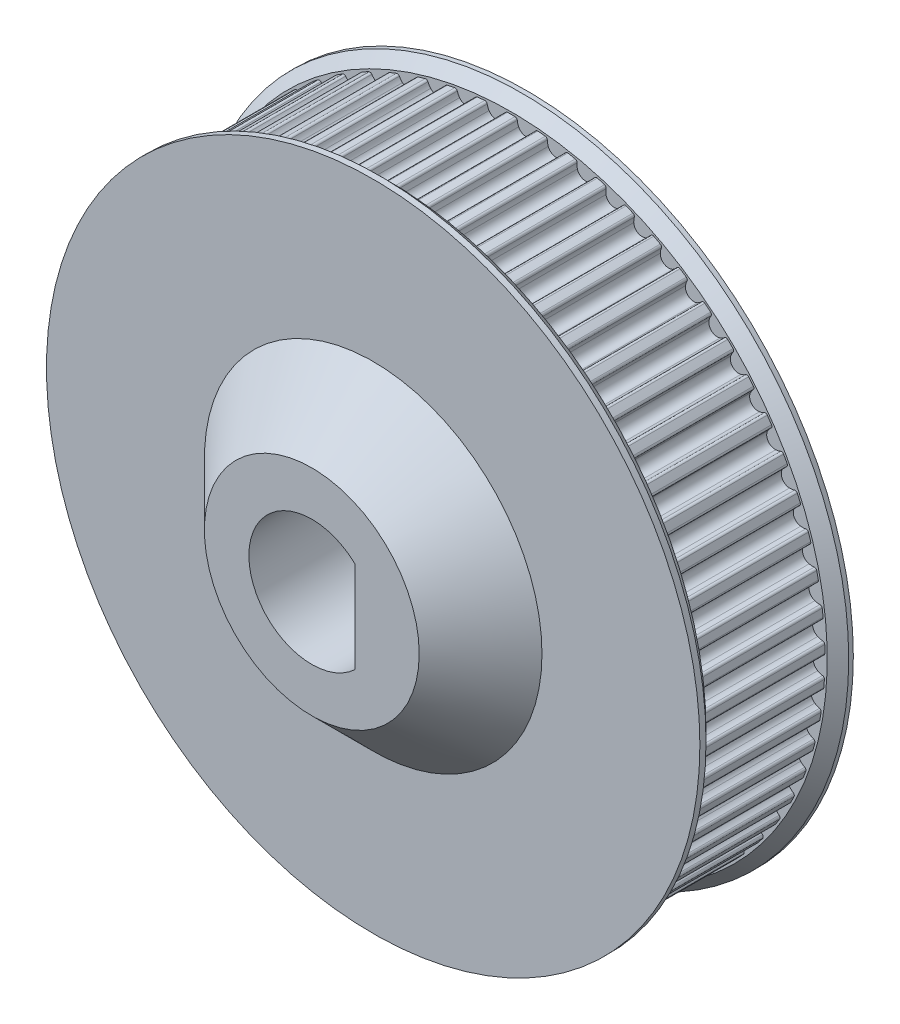
from build123d import *

# Parameters (mm, degrees)
SKETCH1_R           = 20.690142602
BOSS_EXTRUDE1_DEPTH = 4
CUT_EXTRUDE1_DEPTH  = 8
CIRPATTERN1_COUNT   = 65
SKETCH4_R           = 21.290142602
BOSS_EXTRUDE2_DEPTH = 1
CHAMFER1_SIZE       = 0.7
SKETCH6_R           = 7
BOSS_EXTRUDE3_DEPTH = 4
SKETCH5_R           = 4.1
CUT_EXTRUDE2_DEPTH  = 34.204522945
BOSS_EXTRUDE4_DEPTH = 14
CHAMFER2_SIZE       = 4
CHAMFER3_SIZE       = 0.6


with BuildPart() as part:
    # Sketch1 → Boss-Extrude1 (new, symmetric)
    with BuildSketch(Plane.XY):
        Circle(SKETCH1_R)
    extrude(amount=BOSS_EXTRUDE1_DEPTH, both=True)

    # Sketch3 → Cut-Extrude1 (cut)
    with BuildSketch(Plane.XY.offset(4)):
        with BuildLine():
            Line((0, 20.690142602), (0, 20.440142602))
            ThreePointArc((0, 20.440142602), (0.121616533, 20.439780796), (0.243228761, 20.438695393))
            ThreePointArc((0.243228761, 20.438695393), (0.342538687, 20.399520404), (0.390640062, 20.304213536))
            ThreePointArc((0.390640062, 20.304213536), (0.421796483, 20.139835253), (0.479921762, 19.982951874))
            ThreePointArc((0.479921762, 19.982951874), (0.951297332, 19.667148982), (1.450951725, 19.935983286))
            ThreePointArc((1.450951725, 19.935983286), (1.523947083, 20.086524378), (1.570822848, 20.247128255))
            ThreePointArc((1.570822848, 20.247128255), (1.627898107, 20.337347743), (1.73052535, 20.366755058))
            ThreePointArc((1.73052535, 20.366755058), (1.851674604, 20.356098122), (1.972758307, 20.34472055))
            Line((1.972758307, 20.34472055), (1.996886787, 20.593553459))
            ThreePointArc((1.996886787, 20.593553459), (0.999610712, 20.665981209), (0, 20.690142602))
        make_face()
    cut_extrude1 = extrude(amount=-CUT_EXTRUDE1_DEPTH, mode=Mode.SUBTRACT)

    # CirPattern1: Cut-Extrude1 ×65 about axis
    cirpattern1_axis = Axis((0, 0, 0), (0, 0, 1))
    for i in range(1, CIRPATTERN1_COUNT):
        add(cut_extrude1.rotate(cirpattern1_axis, i * 360 / CIRPATTERN1_COUNT), mode=Mode.SUBTRACT)

    # Sketch4 → Boss-Extrude2 (add)
    with BuildSketch(Plane.XY.offset(4)):
        Circle(SKETCH4_R)
    boss_extrude2 = extrude(amount=BOSS_EXTRUDE2_DEPTH)

    # Mirror1: Boss-Extrude2 across plane
    add(boss_extrude2.mirror(Plane.XY))

    # Chamfer1
    chamfer1_edges = [part.edges().sort_by_distance(p)[0] for p in [
        (-21.290142602, 0, -4),
    ]]
    chamfer(chamfer1_edges, length=CHAMFER1_SIZE)

    # Sketch6 → Boss-Extrude3 (add)
    with BuildSketch(Plane.XY.offset(5)):
        Circle(SKETCH6_R)
    extrude(amount=BOSS_EXTRUDE3_DEPTH)

    # Sketch5 → Cut-Extrude2 (cut, through all)
    with BuildSketch(Plane.XY.offset(9)):
        Circle(SKETCH5_R)
    extrude(amount=-CUT_EXTRUDE2_DEPTH, mode=Mode.SUBTRACT)

    # Sketch7 → Boss-Extrude4 (add)
    with BuildSketch(Plane.XY.offset(9)):
        with BuildLine():
            Line((2.8, 2.994995826), (2.8, -2.994995826))
            ThreePointArc((2.8, -2.994995826), (4.1, 0), (2.8, 2.994995826))
        make_face()
    extrude(amount=-BOSS_EXTRUDE4_DEPTH)

    # Chamfer2
    chamfer2_edges = [part.edges().sort_by_distance(p)[0] for p in [
        (-7, 0, 5),
    ]]
    chamfer(chamfer2_edges, length=CHAMFER2_SIZE - 0.0001)  # a hair under: the kernel refuses the full size

    # Chamfer3
    chamfer3_edges = [part.edges().sort_by_distance(p)[0] for p in [
        (-21.290142602, 0, 4),
    ]]
    chamfer(chamfer3_edges, length=CHAMFER3_SIZE)


solid = part.part
